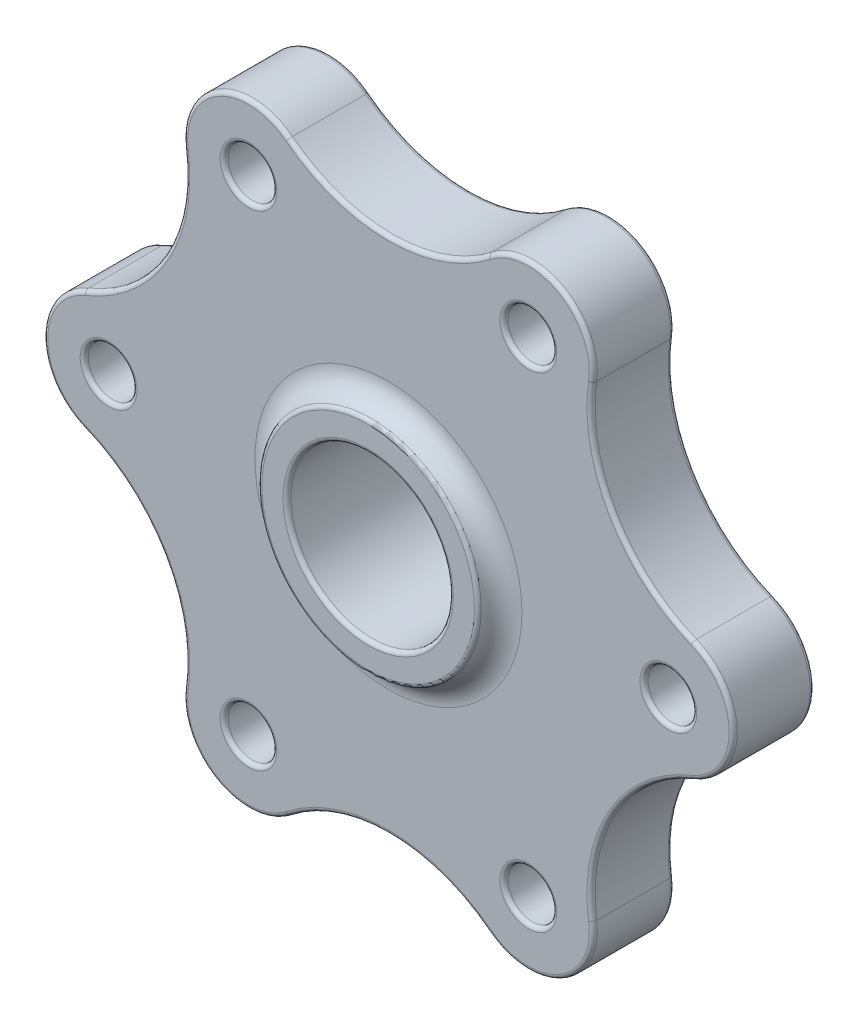
from build123d import *

# Parameters (mm, degrees)
SKETCH1_R           = 13.5
SKETCH1_R_2         = 10
BOSS_EXTRUDE1_DEPTH = 7.5
SKETCH1_7_R         = 13.5
SKETCH1_7_R_2       = 3
BOSS_EXTRUDE2_DEPTH = 5
FILLET1_R           = 3
FILLET2_R           = 0.5


with BuildPart() as part:
    # Sketch1 → Boss-Extrude1 (new, symmetric)
    with BuildSketch(Plane.XY):
        Circle(SKETCH1_R)
        Circle(SKETCH1_R_2, mode=Mode.SUBTRACT)
    extrude(amount=BOSS_EXTRUDE1_DEPTH, both=True)

    # Sketch1<7> → Boss-Extrude2 (add, symmetric)
    with BuildSketch(Plane.XY):
        with BuildLine():
            ThreePointArc((-12.321428571, 36.17939876), (0, 31.933204585), (12.321428571, 36.17939876))
            ThreePointArc((12.321428571, 36.17939876), (21.25, 36.806079661), (25.171564134, 28.760369534))
            ThreePointArc((25.171564134, 28.760369534), (27.654966395, 15.966602293), (37.492992706, 7.419029226))
            ThreePointArc((37.492992706, 7.419029226), (42.5, 0), (37.492992706, -7.419029226))
            ThreePointArc((37.492992706, -7.419029226), (27.654966395, -15.966602293), (25.171564134, -28.760369534))
            ThreePointArc((25.171564134, -28.760369534), (21.25, -36.806079661), (12.321428571, -36.17939876))
            ThreePointArc((12.321428571, -36.17939876), (0, -31.933204585), (-12.321428571, -36.17939876))
            ThreePointArc((-12.321428571, -36.17939876), (-21.25, -36.806079661), (-25.171564134, -28.760369534))
            ThreePointArc((-25.171564134, -28.760369534), (-27.654966395, -15.966602293), (-37.492992706, -7.419029226))
            ThreePointArc((-37.492992706, -7.419029226), (-42.5, 0), (-37.492992706, 7.419029226))
            ThreePointArc((-37.492992706, 7.419029226), (-27.654966395, 15.966602293), (-25.171564134, 28.760369534))
            ThreePointArc((-25.171564134, 28.760369534), (-21.25, 36.806079661), (-12.321428571, 36.17939876))
        make_face()
        Circle(SKETCH1_7_R, mode=Mode.SUBTRACT)
        with Locations((17.25, 29.877876431)):
            Circle(SKETCH1_7_R_2, mode=Mode.SUBTRACT)
        with Locations((-17.25, 29.877876431)):
            Circle(SKETCH1_7_R_2, mode=Mode.SUBTRACT)
        with Locations((-34.5, 0)):
            Circle(SKETCH1_7_R_2, mode=Mode.SUBTRACT)
        with Locations((-17.25, -29.877876431)):
            Circle(SKETCH1_7_R_2, mode=Mode.SUBTRACT)
        with Locations((17.25, -29.877876431)):
            Circle(SKETCH1_7_R_2, mode=Mode.SUBTRACT)
        with Locations((34.5, 0)):
            Circle(SKETCH1_7_R_2, mode=Mode.SUBTRACT)
    extrude(amount=BOSS_EXTRUDE2_DEPTH, both=True)

    # Fillet1
    # the kernel refuses this fillet: 3 mm, written as the material it adds along each edge
    with BuildSketch(Plane(origin=(0, 0, 5), x_dir=(1, 0, 0), z_dir=(0, -1, 0))) as fillet1_piece_1:
        with BuildLine():
            CenterArc((16.458039892, 3), FILLET1_R, 189.594068227, 80.405931773)
            Line((13.5, 2.5), (13.440839202, 2.49))
            ThreePointArc((13.440839202, 2.49), (13.44, 1.25), (13.44, 0))
            Line((13.44, 0), (13.5, -0.06))
            Line((13.5, -0.06), (16.458039892, -0.06))
            Line((16.458039892, -0.06), (16.458039892, 0))
        make_face()
    revolve(axis=Axis((0, 0, 5), (0, 0, 1)))

    # Fillet2
    fillet2_edges = [part.edges().sort_by_distance(p)[0] for p in [
        (0, 31.933204585, 5),
        (-21.25, 36.806079661, -5),
        (-27.654966395, 15.966602293, 5),
        (-42.5, 0, -5),
        (-13.5, 0, 7.5),
        (-27.654966395, -15.966602293, 5),
        (-21.25, -36.806079661, -5),
        (0, -31.933204585, 5),
        (21.25, -36.806079661, -5),
        (27.654966395, -15.966602293, 5),
        (42.5, 0, -5),
        (27.654966395, 15.966602293, 5),
        (14.25, -29.877876431, 5),
        (-20.25, -29.877876431, 5),
        (-37.5, 0, 5),
        (-20.25, 29.877876431, 5),
        (14.25, 29.877876431, 5),
        (21.25, 36.806079661, -5),
        (31.5, 0, 5),
        (-21.25, 36.806079661, 5),
        (-42.5, 0, 5),
        (-21.25, -36.806079661, 5),
        (21.25, -36.806079661, 5),
        (42.5, 0, 5),
        (21.25, 36.806079661, 5),
        (0, 31.933204585, -5),
        (27.654966395, 15.966602293, -5),
        (27.654966395, -15.966602293, -5),
        (0, -31.933204585, -5),
        (-27.654966395, -15.966602293, -5),
        (-27.654966395, 15.966602293, -5),
        (14.25, 29.877876431, -5),
        (-20.25, 29.877876431, -5),
        (-37.5, 0, -5),
        (-20.25, -29.877876431, -5),
        (14.25, -29.877876431, -5),
        (31.5, 0, -5),
        (-13.5, 0, -7.5),
        (-10, 0, -7.5),
        (-10, 0, 7.5),
        (-13.5, 0, -5),
    ]]
    fillet(fillet2_edges, radius=FILLET2_R)


solid = part.part
